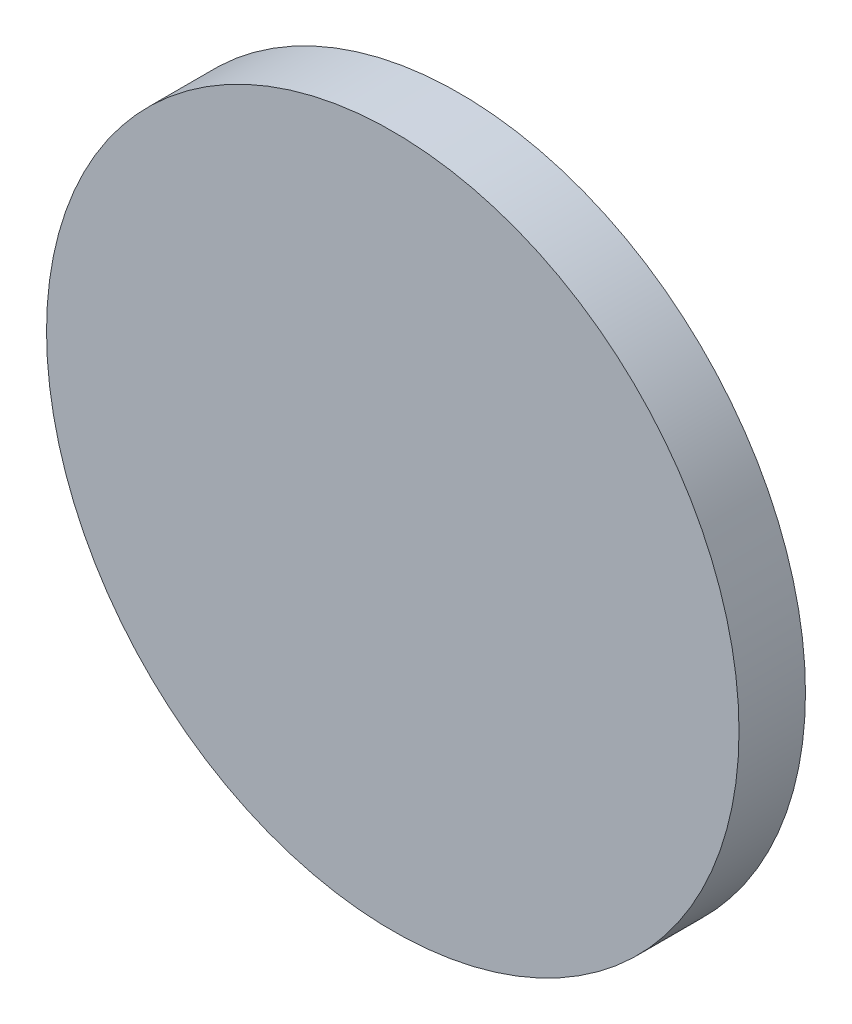
from build123d import *

# Parameters (mm, degrees)
SKETCH1_R           = 52.105052161
BOSS_EXTRUDE1_DEPTH = 10


with BuildPart() as part:
    # Sketch1 → Boss-Extrude1 (new body)
    with BuildSketch(Plane.XY):
        Circle(SKETCH1_R)
    extrude(amount=BOSS_EXTRUDE1_DEPTH)


solid = part.part
